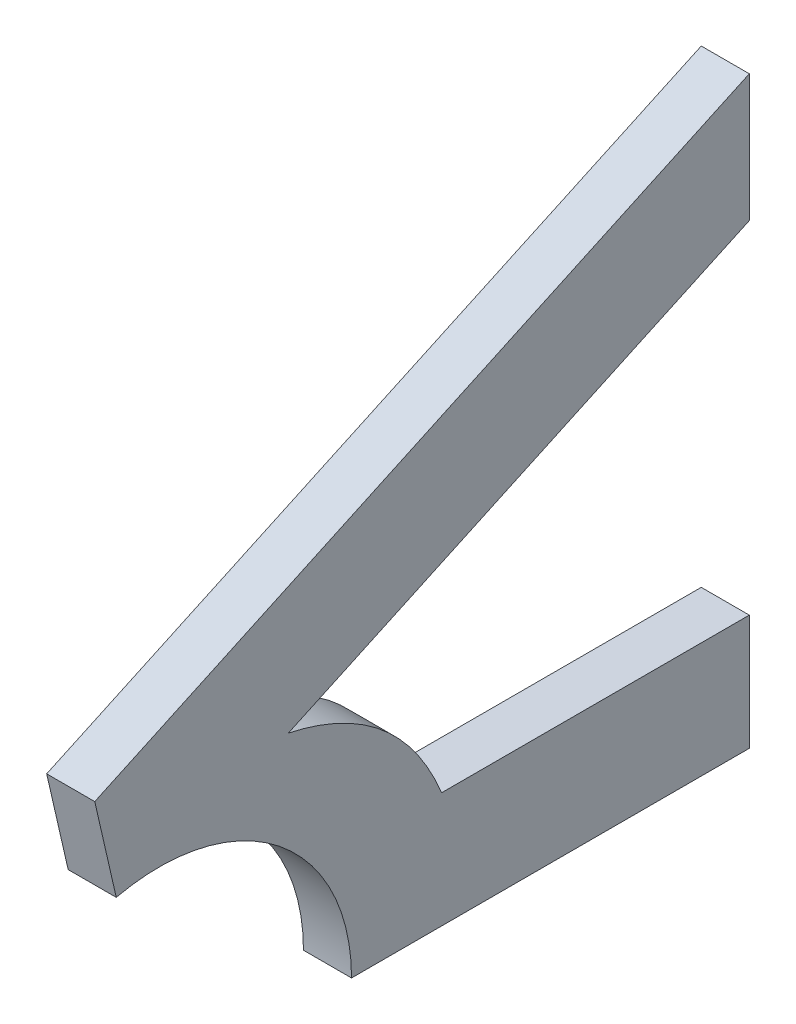
from build123d import *

# Parameters (mm, degrees)
BOSS_EXTRUDE1_DEPTH = 3.175


with BuildPart() as part:
    # Sketch2 → Boss-Extrude1 (new body)
    with BuildSketch(Plane(origin=(-112.555, 0, -573.58969557), x_dir=(0, 0.6231241879767124, 0.7821229100073485), z_dir=(-1, 0, 0))):
        with BuildLine():
            Line((843.785187932, 138.582376841), (864.330586832, 122.213677187))
            ThreePointArc((864.330586832, 122.213677187), (874.263547789, 127), (884.196508746, 122.213677187))
            Line((884.196508746, 122.213677187), (889.162989225, 126.170515781))
            Line((889.162989225, 126.170515781), (867.825427013, 168.756814152))
            Line((867.825427013, 168.756814152), (862.593047153, 162.189320479))
            Line((862.593047153, 162.189320479), (877.618586588, 132.200791366))
            add(Edge.make_bspline(
                [(864.426131776, 131.880269915), (870.948021571, 135.512448445), (877.618586588, 132.200791366)],
                knots=[0, 0, 0, 1, 1, 1], degree=2))
            Line((864.426131776, 131.880269915), (848.533394245, 144.542153415))
            Line((848.533394245, 144.542153415), (843.785187932, 138.582376841))
        make_face()
    extrude(amount=BOSS_EXTRUDE1_DEPTH)


solid = part.part
